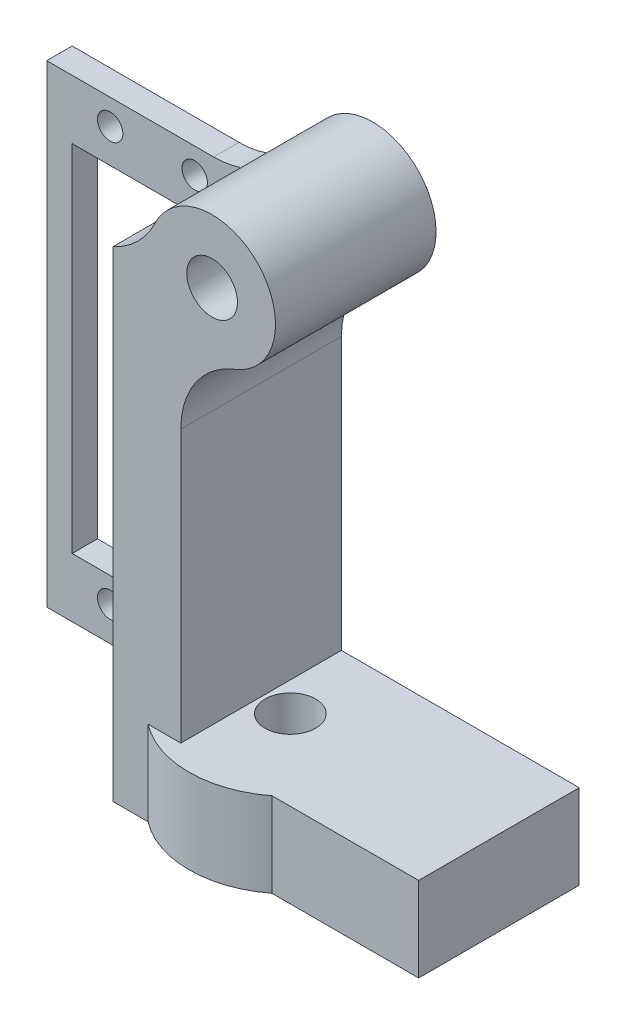
from build123d import *

# Parameters (mm, degrees)
ESQUISSE1_W             = 60
ESQUISSE1_H             = 56
ESQUISSE1_W_2           = 20
ESQUISSE1_H_2           = 42
BOSS_EXTRU_1_DEPTH      = 3
ESQUISSE2_R             = 1.5
ENL_V_MAT_EXTRU_2_DEPTH = 83.127948958
BOSS_EXTRU_2_DEPTH      = 16
ESQUISSE4_W             = 28.138132954
ESQUISSE4_H             = 46
ENL_V_MAT_EXTRU_3_DEPTH = 84.618179841
ESQUISSE5_R             = 7.5
ESQUISSE5_R_2           = 3
BOSS_EXTRU_3_DEPTH      = 19
CONG_1_R                = 10
CONG_2_R                = 10
BOSS_EXTRU_4_DEPTH      = 10
ESQUISSE10_R            = 3
ENL_V_MAT_EXTRU_4_DEPTH = 10
CHANFREIN1_SIZE         = 1


with BuildPart() as part:
    # Esquisse1 → Boss.-Extru.1 (new body)
    with BuildSketch(Plane.XY):
        with Locations((30, 28)):
            Rectangle(ESQUISSE1_W, ESQUISSE1_H)
        with Locations((13, 28)):
            Rectangle(ESQUISSE1_W_2, ESQUISSE1_H_2, mode=Mode.SUBTRACT)
    extrude(amount=BOSS_EXTRU_1_DEPTH)

    # Esquisse2 → Enlèv. mat.-Extru.2 (cut, through all)
    with BuildSketch(Plane.XY.offset(3)):
        with Locations((7.5, 53)):
            Circle(ESQUISSE2_R)
        with Locations((17.5, 53)):
            Circle(ESQUISSE2_R)
        with Locations((7.5, 4)):
            Circle(ESQUISSE2_R)
        with Locations((17.5, 4)):
            Circle(ESQUISSE2_R)
    extrude(amount=-ENL_V_MAT_EXTRU_2_DEPTH, mode=Mode.SUBTRACT)

    # Esquisse3 → Boss.-Extru.2 (add)
    with BuildSketch(Plane.XY.offset(3)):
        Polygon((23.861867046, 56), (31.861867046, 56), (31.861867046, 10), (60, 10), (60, 0), (23.861867046, 0), align=None)
    extrude(amount=BOSS_EXTRU_2_DEPTH)

    # Esquisse4 → Enlèv. mat.-Extru.3 (cut, through all)
    with BuildSketch(Plane.XY.offset(3)):
        with Locations((45.930933523, 33)):
            Rectangle(ESQUISSE4_W, ESQUISSE4_H)
    extrude(amount=-ENL_V_MAT_EXTRU_3_DEPTH, mode=Mode.SUBTRACT)

    # Esquisse5 → Boss.-Extru.3 (add)
    with BuildSketch(Plane(origin=(0, 0, 0), x_dir=(-1, 0, 0), z_dir=(0, 0, -1))):
        with Locations((-35.561058301, 58.5)):
            Circle(ESQUISSE5_R)
        with Locations((-35.561058301, 58.5)):
            Circle(ESQUISSE5_R_2, mode=Mode.SUBTRACT)
    extrude(amount=-BOSS_EXTRU_3_DEPTH)

    # Congé1
    cong_1_edges = [part.edges().sort_by_distance(p)[0] for p in [
        (28.489990489, 56, 9.5),
    ]]
    fillet(cong_1_edges, radius=CONG_1_R)

    # Congé2
    cong_2_edges = [part.edges().sort_by_distance(p)[0] for p in [
        (31.861867046, 51.975738811, 9.5),
    ]]
    fillet(cong_2_edges, radius=CONG_2_R)

    # Esquisse9 → Boss.-Extru.4 (add)
    with BuildSketch(Plane.XZ):
        with BuildLine():
            Line((42.649653768, 19), (27.986775469, 19))
            ThreePointArc((27.986775469, 19), (35.318214618, 21.5), (42.649653768, 19))
        make_face()
    extrude(amount=-BOSS_EXTRU_4_DEPTH)

    # Esquisse10 → Enlèv. mat.-Extru.4 (cut)
    with BuildSketch(Plane.XZ):
        with Locations(Location((35.318214618, 9.5, 0), (0, 0, 270))):
            Circle(ESQUISSE10_R)
    extrude(amount=-ENL_V_MAT_EXTRU_4_DEPTH, mode=Mode.SUBTRACT)

    # Chanfrein1
    # the kernel refuses this chamfer: 1 mm, written as the material it adds along each edge
    with BuildSketch(Plane(origin=(23.861867046, 0, 3), x_dir=(0.027495876610585623, 0, 0.9996219169112968), z_dir=(0, 1, 0))) as chanfrein1_piece_1_section:
        Polygon((CHANFREIN1_SIZE * 0.999621916911, -CHANFREIN1_SIZE * 0.0274958766106), (-CHANFREIN1_SIZE * 0.0274958766106, -CHANFREIN1_SIZE * 0.999621916911), (0, 0), align=None)
    chanfrein1_piece_1 = extrude(amount=59.456320381, mode=Mode.PRIVATE)
    chanfrein1_piece_1 = split(chanfrein1_piece_1, bisect_by=Plane(origin=(23, 3.5, 3.33918952), z_dir=(1, 0, 0)), keep=Keep.TOP, mode=Mode.PRIVATE)
    chanfrein1_piece_1 = split(chanfrein1_piece_1, bisect_by=Plane(origin=(23.549970381, 7, 3.33918952), z_dir=(0, -1, 0)), keep=Keep.TOP, mode=Mode.PRIVATE)
    add(chanfrein1_piece_1)
    with BuildSketch(Plane(origin=(23.861867046, 0, 3), x_dir=(0.027495876610585623, 0, 0.9996219169112968), z_dir=(0, 1, 0))) as chanfrein1_piece_2_section:
        Polygon((CHANFREIN1_SIZE * 0.999621916911, -CHANFREIN1_SIZE * 0.0274958766106), (-CHANFREIN1_SIZE * 0.0274958766106, -CHANFREIN1_SIZE * 0.999621916911), (0, 0), align=None)
    chanfrein1_piece_2 = extrude(amount=59.456320381, mode=Mode.PRIVATE)
    chanfrein1_piece_2 = split(chanfrein1_piece_2, bisect_by=Plane(origin=(23, 3.5, 3.018362183), z_dir=(-1, 0, 0)), keep=Keep.TOP, mode=Mode.PRIVATE)
    chanfrein1_piece_2 = split(chanfrein1_piece_2, bisect_by=Plane(origin=(22.938869919, 7, 3.018362183), z_dir=(0, -1, 0)), keep=Keep.TOP, mode=Mode.PRIVATE)
    add(chanfrein1_piece_2)
    with BuildSketch(Plane(origin=(23.861867046, 0, 3), x_dir=(0.027495876610585623, 0, 0.9996219169112968), z_dir=(0, 1, 0))) as chanfrein1_piece_3_section:
        Polygon((CHANFREIN1_SIZE * 0.999621916911, -CHANFREIN1_SIZE * 0.0274958766106), (-CHANFREIN1_SIZE * 0.0274958766106, -CHANFREIN1_SIZE * 0.999621916911), (0, 0), align=None)
    chanfrein1_piece_3 = extrude(amount=59.456320381, mode=Mode.PRIVATE)
    chanfrein1_piece_3 = split(chanfrein1_piece_3, bisect_by=Plane(origin=(23.549970381, 49, 3.33918952), z_dir=(0, -1, 0)), keep=Keep.TOP, mode=Mode.PRIVATE)
    chanfrein1_piece_3 = split(chanfrein1_piece_3, bisect_by=Plane(origin=(23, 28, 3.33918952), z_dir=(1, 0, 0)), keep=Keep.TOP, mode=Mode.PRIVATE)
    chanfrein1_piece_3 = split(chanfrein1_piece_3, bisect_by=Plane(origin=(23.549970381, 7, 3.33918952), z_dir=(0, 1, 0)), keep=Keep.TOP, mode=Mode.PRIVATE)
    add(chanfrein1_piece_3)
    with BuildSketch(Plane(origin=(23.861867046, 0, 3), x_dir=(0.027495876610585623, 0, 0.9996219169112968), z_dir=(0, 1, 0))) as chanfrein1_piece_4_section:
        Polygon((CHANFREIN1_SIZE * 0.999621916911, -CHANFREIN1_SIZE * 0.0274958766106), (-CHANFREIN1_SIZE * 0.0274958766106, -CHANFREIN1_SIZE * 0.999621916911), (0, 0), align=None)
    chanfrein1_piece_4 = extrude(amount=59.456320381, mode=Mode.PRIVATE)
    chanfrein1_piece_4 = chanfrein1_piece_4 - Plane(origin=(19.74967, 66, 3.340715055), x_dir=(0.9035079029052511, -0.42857142857142916, 0), z_dir=(0, 0, -1)) * Cylinder(10, 123, mode=Mode.PRIVATE)
    chanfrein1_piece_4 = split(chanfrein1_piece_4, bisect_by=Plane(origin=(23.552807477, 49, 3.340715055), z_dir=(0, 1, 0)), keep=Keep.TOP, mode=Mode.PRIVATE)
    chanfrein1_piece_4 = split(chanfrein1_piece_4, bisect_by=Plane(origin=(23, 52.877415303, 3.340715055), z_dir=(1, 0, 0)), keep=Keep.TOP, mode=Mode.PRIVATE)
    add(chanfrein1_piece_4)
    with BuildSketch(Plane(origin=(23.861867046, 0, 3), x_dir=(0.027495876610585623, 0, 0.9996219169112968), z_dir=(0, 1, 0))) as chanfrein1_piece_5_section:
        Polygon((CHANFREIN1_SIZE * 0.999621916911, -CHANFREIN1_SIZE * 0.0274958766106), (-CHANFREIN1_SIZE * 0.0274958766106, -CHANFREIN1_SIZE * 0.999621916911), (0, 0), align=None)
    chanfrein1_piece_5 = extrude(amount=59.456320381, mode=Mode.PRIVATE)
    chanfrein1_piece_5 = chanfrein1_piece_5 - Plane(origin=(19.74967, 66, 3.018405741), x_dir=(0.9035079029052511, -0.42857142857142916, 0), z_dir=(0, 0, -1)) * Cylinder(10, 123, mode=Mode.PRIVATE)
    chanfrein1_piece_5 = split(chanfrein1_piece_5, bisect_by=Plane(origin=(22.938951148, 49, 3.018405741), z_dir=(0, 1, 0)), keep=Keep.TOP, mode=Mode.PRIVATE)
    chanfrein1_piece_5 = split(chanfrein1_piece_5, bisect_by=Plane(origin=(23, 52.761158893, 3.018405741), z_dir=(-1, 0, 0)), keep=Keep.TOP, mode=Mode.PRIVATE)
    add(chanfrein1_piece_5)


solid = part.part
